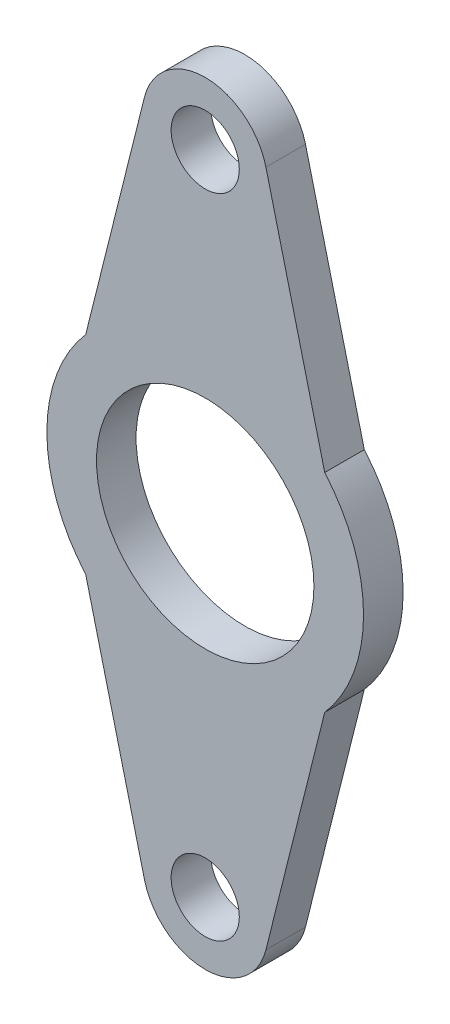
from build123d import *

# Parameters (mm, degrees)
SKETCH1_R           = 17.441957863
SKETCH1_R_2         = 5.4689375
BOSS_EXTRUDE1_DEPTH = 6.35


with BuildPart() as part:
    # Sketch1 → Boss-Extrude1 (new body)
    with BuildSketch(Plane.XY):
        with BuildLine():
            Line((19.172131573, 16.661013503), (9.740891327, 54.369598862))
            ThreePointArc((9.740891327, 54.369598862), (0, 61.974255991), (-9.740891326, 54.369598862))
            Line((-9.740891327, 54.369598862), (-19.172131573, 16.661013503))
            ThreePointArc((-19.172131573, 16.661013503), (-25.4, 0), (-19.172131573, -16.661013503))
            Line((-19.172131573, -16.661013503), (-9.740891327, -54.369598862))
            ThreePointArc((-9.740891326, -54.369598862), (0, -61.974255991), (9.740891327, -54.369598862))
            Line((9.740891327, -54.369598862), (19.172131573, -16.661013503))
            ThreePointArc((19.172131573, -16.661013503), (25.4, 0), (19.172131573, 16.661013503))
        make_face()
        Circle(SKETCH1_R, mode=Mode.SUBTRACT)
        with Locations((0, 51.933318491)):
            Circle(SKETCH1_R_2, mode=Mode.SUBTRACT)
        with Locations((0, -51.933318491)):
            Circle(SKETCH1_R_2, mode=Mode.SUBTRACT)
    extrude(amount=BOSS_EXTRUDE1_DEPTH)


solid = part.part
